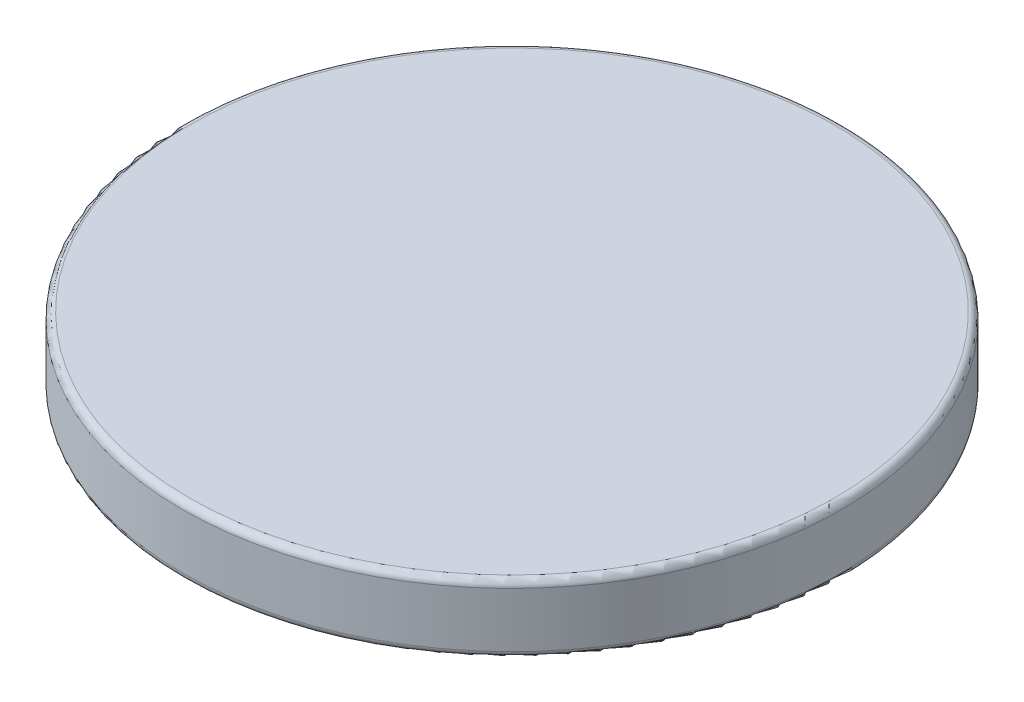
from build123d import *

# Parameters (mm, degrees)
SKETCH2_R           = 61.214
BOSS_EXTRUDE1_DEPTH = 12.7
FILLET1_R           = 1.27


with BuildPart() as part:
    # Sketch2 → Boss-Extrude1 (new body)
    with BuildSketch(Plane(origin=(0, 0, 0), x_dir=(1, 0, 0), z_dir=(0, 1, 0))):
        Circle(SKETCH2_R)
    extrude(amount=-BOSS_EXTRUDE1_DEPTH)

    # Fillet1
    fillet1_edges = [part.edges().sort_by_distance(p)[0] for p in [
        (-61.214, -12.7, 0),
        (-61.214, 0, 0),
    ]]
    fillet(fillet1_edges, radius=FILLET1_R)


solid = part.part
